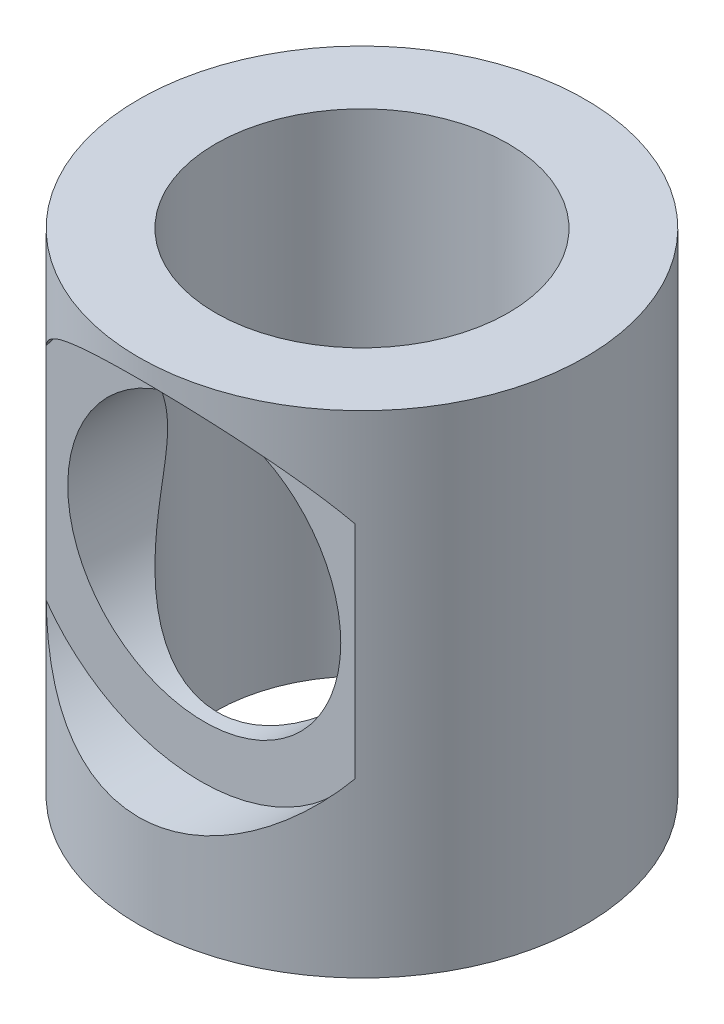
from build123d import *

# Parameters (mm, degrees)
SKETCH1_R               = 9
SKETCH1_R_2             = 5.9
BOSS_EXTRUDE1_DEPTH     = 19.8
CUT_EXTRUDE5_START      = 6.5
SKETCH3_R               = 7.65
CUT_EXTRUDE5_DEPTH      = 18.038054295
CUT_EXTRUDE6_DEPTH      = 27.707489752
CUT_EXTRUDE6_DEPTH_BACK = 7
SKETCH6_R               = 5.5


with BuildPart() as part:
    # Sketch1 → Boss-Extrude1 (new body)
    with BuildSketch(Plane(origin=(0, 0, 0), x_dir=(1, 0, 0), z_dir=(0, 1, 0))):
        Circle(SKETCH1_R)
        Circle(SKETCH1_R_2, mode=Mode.SUBTRACT)
    extrude(amount=-BOSS_EXTRUDE1_DEPTH)

    # Sketch3 → Cut-Extrude5 (cut, through all)
    with BuildSketch(Plane.XY.offset(CUT_EXTRUDE5_START)):
        with Locations((0, -8.4)):
            Circle(SKETCH3_R)
    extrude(amount=CUT_EXTRUDE5_DEPTH, mode=Mode.SUBTRACT)

    # Sketch6 → Cut-Extrude6 (cut, two sides: drawn at the far end of the back side and taken through both)
    with BuildSketch(Plane.XY.offset(6.5).offset(-CUT_EXTRUDE6_DEPTH_BACK)):
        with Locations((0.145476138, -8.4)):
            Circle(SKETCH6_R)
    extrude(amount=CUT_EXTRUDE6_DEPTH + CUT_EXTRUDE6_DEPTH_BACK, mode=Mode.SUBTRACT)


solid = part.part
